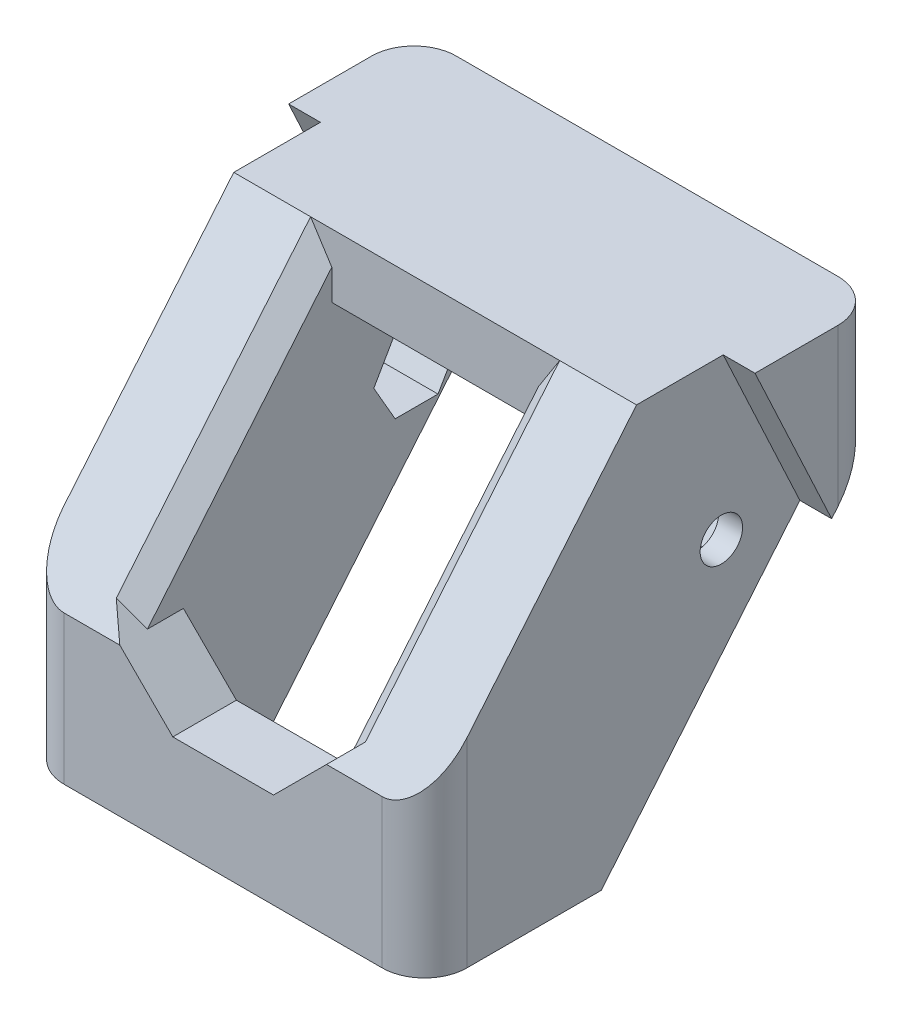
from build123d import *

# Parameters (mm, degrees)
BOSS_EXTRUDE1_DEPTH = 19
CUT_EXTRUDE1_DEPTH  = 9.75
SKETCH5_R           = 2
CUT_EXTRUDE3_DEPTH  = 55.954526656
BOSS_EXTRUDE3_DEPTH = 3
CUT_EXTRUDE4_DEPTH  = 53.535702146
CUT_EXTRUDE6_START  = -7
CUT_EXTRUDE6_DEPTH  = 33.5
FILLET1_R           = 4
CHAMFER2_SIZE       = 2


with BuildPart() as part:
    # Sketch1 → Boss-Extrude1 (new, symmetric)
    with BuildSketch(Plane(origin=(0, 0, 0), x_dir=(0, 0, -1), z_dir=(1, 0, 0))):
        Polygon((-10, -12), (-10, -26), (6.666666667, -26), (30, 2), (30, 12), (10, 12), align=None)
    extrude(amount=BOSS_EXTRUDE1_DEPTH, both=True)

    # Sketch2 → Cut-Extrude1 (cut, symmetric)
    with BuildSketch(Plane(origin=(0, 0, 0), x_dir=(0, 0, -1), z_dir=(1, 0, 0))):
        Polygon((30, 6), (10, 6), (10, 12), (-4, 12), (-4, 6), (-10, 6), (-10, -12), (-4, -12), (-4, -26), (30, -26), align=None)
    extrude(amount=CUT_EXTRUDE1_DEPTH, both=True, mode=Mode.SUBTRACT)

    # Sketch5 → Cut-Extrude3 (cut, through all)
    with BuildSketch(Plane(origin=(19, 0, 0), x_dir=(0, 0, -1), z_dir=(1, 0, 0))):
        with Locations((18, -3)):
            Circle(SKETCH5_R)
    extrude(amount=-CUT_EXTRUDE3_DEPTH, mode=Mode.SUBTRACT)

    # Sketch6 → Boss-Extrude3 (add)
    with BuildSketch(Plane(origin=(19, 0, 0), x_dir=(0, 0, -1), z_dir=(1, 0, 0))):
        Polygon((18.177341601, 12), (25.409256694, -3.508891967), (30, 2), (30, 12), align=None)
    boss_extrude3 = extrude(amount=BOSS_EXTRUDE3_DEPTH)

    # Sketch7 → Cut-Extrude4 (cut, through all)
    with BuildSketch(Plane.XY.offset(10)):
        Polygon((-9.75, -12), (-4.75, -17), (4.75, -17), (9.75, -12), align=None)
    extrude(amount=-CUT_EXTRUDE4_DEPTH, mode=Mode.SUBTRACT)

    # Mirror2: Boss-Extrude3 across plane
    add(boss_extrude3.mirror(Plane(origin=(0, 0, 0), x_dir=(0, 0, 1), z_dir=(1, 0, 0))))

    # Sketch9 → Cut-Extrude6 (cut)
    with BuildSketch(Plane(origin=(-9.75, 0, 0), x_dir=(0, 0, -1), z_dir=(1, 0, 0)).offset(CUT_EXTRUDE6_START)):
        Polygon((13.958548116, -3), (15.979274058, -6.5), (20.020725942, -6.5), (22.041451884, -3), (20.020725942, 0.5), (15.979274058, 0.5), align=None)
    extrude(amount=CUT_EXTRUDE6_DEPTH, mode=Mode.SUBTRACT)

    # Fillet1
    fillet1_edges = [part.edges().sort_by_distance(p)[0] for p in [
        (22, 7, -30),
        (19, -19, 10),
        (-19, -19, 10),
        (-22, 7, -30),
    ]]
    fillet(fillet1_edges, radius=FILLET1_R)

    # Chamfer2
    # the kernel refuses this chamfer: 2 mm, written as the material it takes off along each edge
    with BuildSketch(Plane(origin=(-9.75, -15.951243191, 13.29270266), x_dir=(-0.9996219169112968, 0.017602431261197007, 0.02112291751343641), z_dir=(0, 0.7682212795973759, -0.6401843996644799))) as chamfer2_piece_1_section:
        Polygon((CHAMFER2_SIZE * 0.999621916911, -CHAMFER2_SIZE * 0.0274958766106), (-CHAMFER2_SIZE * 0.0274958766106, -CHAMFER2_SIZE * 0.999621916911), (0, 0), align=None)
    chamfer2_piece_1 = extrude(amount=41.527730655, mode=Mode.PRIVATE)
    chamfer2_piece_1 = split(chamfer2_piece_1, bisect_by=Plane(origin=(-15.992155631, -5.757844369, -0.703880227), z_dir=(0.7071067811865478, 0.7071067811865474, 0)), keep=Keep.TOP, mode=Mode.PRIVATE)
    chamfer2_piece_1 = split(chamfer2_piece_1, bisect_by=Plane(origin=(-10.414483767, -0.180172505, -10), z_dir=(0, 0, 1)), keep=Keep.TOP, mode=Mode.PRIVATE)
    add(chamfer2_piece_1, mode=Mode.SUBTRACT)
    with BuildSketch(Plane(origin=(-9.75, -29.951243191, -3.373964007), x_dir=(0.02749587661058651, 0.639942356769315, 0.7679308281231783), z_dir=(0, 0.768221279597376, -0.6401843996644798))) as chamfer2_piece_2:
        Polygon((CHAMFER2_SIZE * 0.999621916911, -CHAMFER2_SIZE * 0.0274958766106), (-CHAMFER2_SIZE * 0.0274958766106, -CHAMFER2_SIZE * 0.999621916911), (0, 0), align=None)
    extrude(amount=46.734563773, mode=Mode.SUBTRACT)
    with BuildSketch(Plane(origin=(9.75, -15.951243191, 13.29270266), x_dir=(0.9996219169112968, 0.017602431261197007, 0.02112291751343641), z_dir=(0, 0.7682212795973759, -0.6401843996644799))) as chamfer2_piece_3_section:
        Polygon((CHAMFER2_SIZE * 0.999621916911, CHAMFER2_SIZE * 0.0274958766106), (-CHAMFER2_SIZE * 0.0274958766106, CHAMFER2_SIZE * 0.999621916911), (0, 0), align=None)
    chamfer2_piece_3 = extrude(amount=41.527730655, mode=Mode.PRIVATE)
    chamfer2_piece_3 = split(chamfer2_piece_3, bisect_by=Plane(origin=(15.992155631, -5.757844369, -0.703880227), z_dir=(-0.7071067811865477, 0.7071067811865475, 0)), keep=Keep.TOP, mode=Mode.PRIVATE)
    chamfer2_piece_3 = split(chamfer2_piece_3, bisect_by=Plane(origin=(10.414483767, -0.180172505, -10), z_dir=(0, 0, 1)), keep=Keep.TOP, mode=Mode.PRIVATE)
    add(chamfer2_piece_3, mode=Mode.SUBTRACT)
    with BuildSketch(Plane(origin=(9.75, 5.951243191, -33.29270266), x_dir=(0.9996219169112968, -0.017602431261197003, -0.02112291751343641), z_dir=(0, -0.768221279597376, 0.6401843996644798))) as chamfer2_piece_4:
        Polygon((CHAMFER2_SIZE * 0.999621916911, CHAMFER2_SIZE * 0.0274958766106), (-CHAMFER2_SIZE * 0.0274958766106, CHAMFER2_SIZE * 0.999621916911), (0, 0), align=None)
    extrude(amount=46.734563773, mode=Mode.SUBTRACT)


solid = part.part
